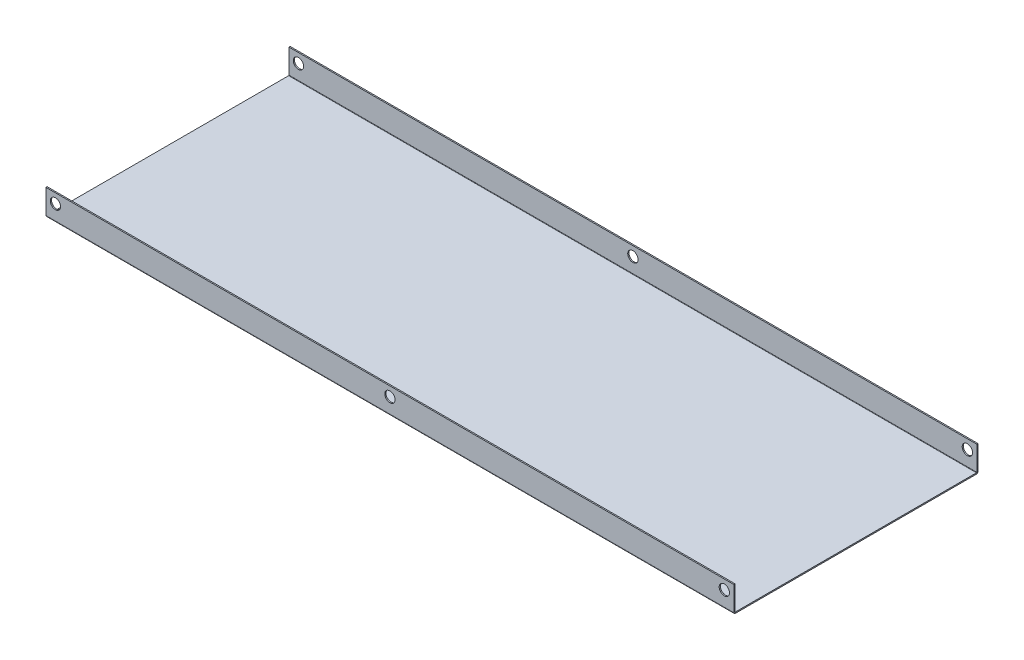
from build123d import *

# Parameters (mm, degrees)
SKETCH_1_W                         = 400
SKETCH_1_H                         = 142
SM_BASE_FLANGE_1_DEPTH             = 0.7
SM_EDGE_FLANGE_1_STRIP_W           = 3.2
SM_EDGE_FLANGE_1_STRIP_H           = 0.7
SM_EDGE_FLANGE_1_STRIP_CUT_DEPTH   = 400
SM_EDGE_FLANGE_1_STRIP_2_W         = 3.2
SM_EDGE_FLANGE_1_STRIP_2_H         = 0.7
SM_EDGE_FLANGE_1_STRIP_CUT_2_DEPTH = 400
SM_EDGE_FLANGE_1_DEPTH             = 400
SM_EDGE_FLANGE_1_BEND_DEPTH        = 400
SKETCH_17_R                        = 3
CUT_EXTRUDE_1_DEPTH                = 10
CUT_EXTRUDE_START                  = -10
SKETCH_18_R                        = 3
CUT_EXTRUDE_2_DEPTH                = 10


# Sheet-metal steps are written as plain solids
with BuildPart() as part:
    # 草图1 → 基体-法兰1 (new body)
    with BuildSketch(Plane(origin=(0, 0, 0), x_dir=(1, 0, 0), z_dir=(0, 1, 0))):
        Rectangle(SKETCH_1_W, SKETCH_1_H)
    extrude(amount=-SM_BASE_FLANGE_1_DEPTH)

    # 边线-法兰1 strip (across the edge) → 边线-法兰1 strip cut (cut)
    with BuildSketch(Plane(origin=(200, 0, -71), x_dir=(0, 0, 1), z_dir=(-1, 0, 0))):
        with Locations((-0.7, -0.35)):
            Rectangle(SM_EDGE_FLANGE_1_STRIP_W, SM_EDGE_FLANGE_1_STRIP_H)
    extrude(amount=SM_EDGE_FLANGE_1_STRIP_CUT_DEPTH, mode=Mode.SUBTRACT)

    # 边线-法兰1 strip 2 (across the edge) → 边线-法兰1 strip cut 2 (cut)
    with BuildSketch(Plane(origin=(-200, 0, 71), x_dir=(0, 0, -1), z_dir=(1, 0, 0))):
        with Locations((-0.7, -0.35)):
            Rectangle(SM_EDGE_FLANGE_1_STRIP_2_W, SM_EDGE_FLANGE_1_STRIP_2_H)
    extrude(amount=SM_EDGE_FLANGE_1_STRIP_CUT_2_DEPTH, mode=Mode.SUBTRACT)

    # 边线-法兰1 section (across the edge) → 边线-法兰1 (add)
    with BuildSketch(Plane(origin=(200, 0, -71), x_dir=(0, 0, 1), z_dir=(-1, 0, 0))):
        with BuildLine():
            Line((0, 0.2), (0, 14.3))
            Line((0, 14.3), (0.7, 14.3))
            Line((0.7, 14.3), (0.7, 0.2))
            ThreePointArc((0.7, 0.2), (0.758578644, 0.058578644), (0.9, 0))
            Line((0.9, 0), (0.9, -0.7))
            ThreePointArc((0.9, -0.7), (0.263603897, -0.436396103), (0, 0.2))
        make_face()
    extrude(amount=SM_EDGE_FLANGE_1_DEPTH)

    # 边线-法兰1 section 2 (across the edge) → 边线-法兰1 bend (add)
    with BuildSketch(Plane(origin=(-200, 0, 71), x_dir=(0, 0, -1), z_dir=(1, 0, 0))):
        with BuildLine():
            Line((0, 0.2), (0, 14.3))
            Line((0, 14.3), (0.7, 14.3))
            Line((0.7, 14.3), (0.7, 0.2))
            ThreePointArc((0.7, 0.2), (0.758578644, 0.058578644), (0.9, 0))
            Line((0.9, 0), (0.9, -0.7))
            ThreePointArc((0.9, -0.7), (0.263603897, -0.436396103), (0, 0.2))
        make_face()
    extrude(amount=SM_EDGE_FLANGE_1_BEND_DEPTH)

    # 草图17 → 切除-拉伸1 (cut)
    with BuildSketch(Plane(origin=(0, 0, -71), x_dir=(-1, 0, 0), z_dir=(0, 0, -1))):
        with Locations(Location((-194.5, 8.8, 0), (0, 0, 90))):
            Circle(SKETCH_17_R)
        with Locations(Location((0, 8.8, 0), (0, 0, 90))):
            Circle(SKETCH_17_R)
        with Locations(Location((194.5, 8.8, 0), (0, 0, 270))):
            Circle(SKETCH_17_R)
    extrude(amount=-CUT_EXTRUDE_1_DEPTH, mode=Mode.SUBTRACT)

    # 草图18 → 切除-拉伸2 (cut)
    with BuildSketch(Plane.XY.offset(71).offset(CUT_EXTRUDE_START)):
        with Locations(Location((-194.5, 8.8, 0), (0, 0, 270))):
            Circle(SKETCH_18_R)
        with Locations(Location((0, 8.8, 0), (0, 0, 90))):
            Circle(SKETCH_18_R)
        with Locations(Location((194.5, 8.8, 0), (0, 0, 90))):
            Circle(SKETCH_18_R)
    extrude(amount=CUT_EXTRUDE_2_DEPTH, mode=Mode.SUBTRACT)


solid = part.part
